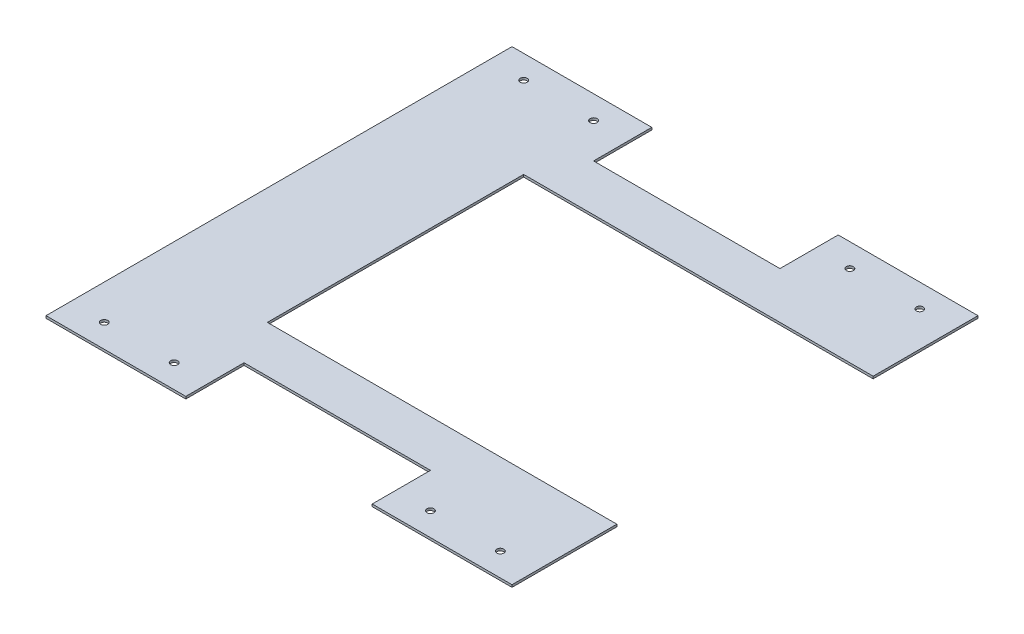
from build123d import *

# Parameters (mm, degrees)
ESQUISSE1_R        = 1.5
BOSS_EXTRU_1_DEPTH = 1


with BuildPart() as part:
    # Esquisse1 → Boss.-Extru.1 (new body)
    with BuildSketch(Plane(origin=(0, 0, 0), x_dir=(1, 0, 0), z_dir=(0, 1, 0))):
        Polygon((-40, 100), (-40, 75), (40, 75), (40, 100), (100, 100), (100, 55), (-50, 55), (-50, -55), (100, -55), (100, -100), (40, -100), (40, -75), (-40, -75), (-40, -100), (-100, -100), (-100, 100), align=None)
        with Locations((-85, 90)):
            Circle(ESQUISSE1_R, mode=Mode.SUBTRACT)
        with Locations((-55, 90)):
            Circle(ESQUISSE1_R, mode=Mode.SUBTRACT)
        with Locations((-55, -90)):
            Circle(ESQUISSE1_R, mode=Mode.SUBTRACT)
        with Locations((-85, -90)):
            Circle(ESQUISSE1_R, mode=Mode.SUBTRACT)
        with Locations((55, -90)):
            Circle(ESQUISSE1_R, mode=Mode.SUBTRACT)
        with Locations((85, -90)):
            Circle(ESQUISSE1_R, mode=Mode.SUBTRACT)
        with Locations((55, 90)):
            Circle(ESQUISSE1_R, mode=Mode.SUBTRACT)
        with Locations((85, 90)):
            Circle(ESQUISSE1_R, mode=Mode.SUBTRACT)
    extrude(amount=BOSS_EXTRU_1_DEPTH)


solid = part.part
